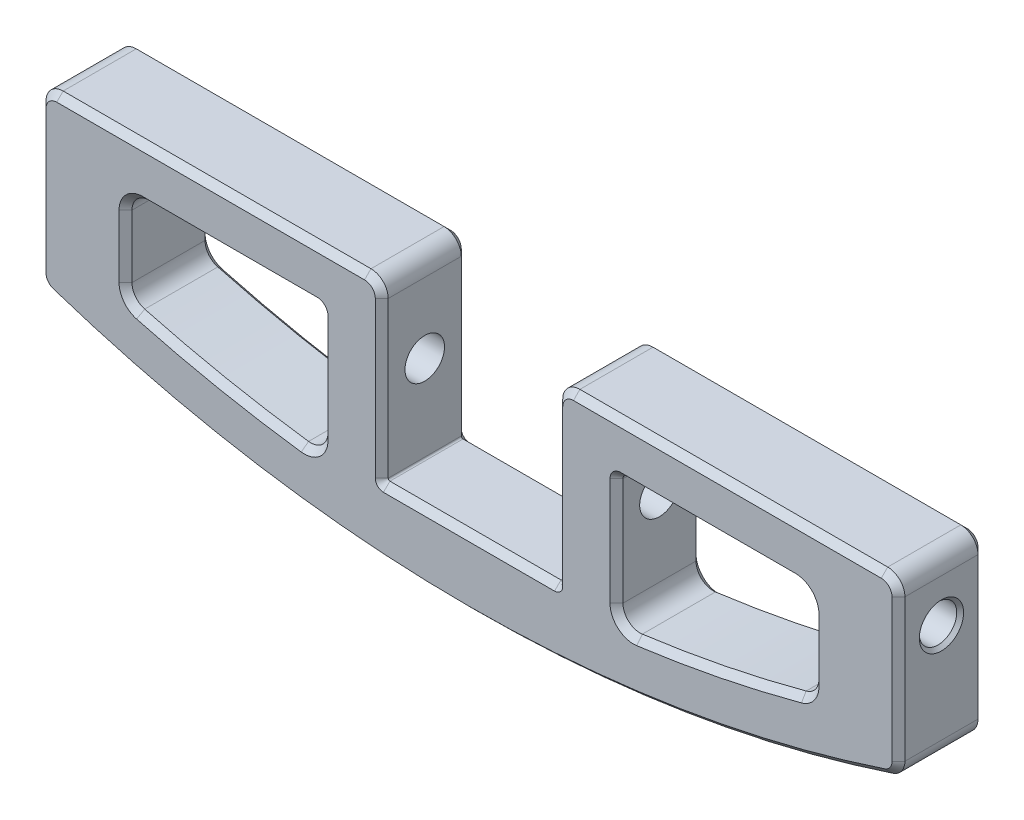
from build123d import *

# Parameters (mm, degrees)
AUFSATZ_LINEAR_AUSTRAGEN1_DEPTH      = 10
SKIZZE2_R                            = 2.175
SCHNITT_LINEAR_AUSTRAGEN1_DEPTH      = 8
SCHNITT_LINEAR_AUSTRAGEN2_DEPTH      = 30
SCHNITT_LINEAR_AUSTRAGEN2_DEPTH_BACK = 10
SKIZZE3_R                            = 2.3
VERRUNDUNG1_R                        = 2
VERRUNDUNG2_R                        = 0.2
VERRUNDUNG3_R                        = 0.5
FASE1_SIZE                           = 0.75
FASE2_SIZE                           = 0.4


with BuildPart() as part:
    # Skizze1 → Aufsatz-Linear austragen1 (new body)
    with BuildSketch(Plane.XY):
        with BuildLine():
            Line((10.15, 0), (10.15, -20.3))
            Line((10.15, -20.3), (-10.15, -20.3))
            Line((-10.15, -20.3), (-10.15, 0))
            Line((-10.15, 0), (-49.95, 0))
            Line((-49.95, 0), (-49.95, -20))
            ThreePointArc((-49.95, -20), (-25.317447047, -26.210871087), (0, -28.3))
            ThreePointArc((0, -28.3), (25.317447047, -26.210871087), (49.95, -20))
            Line((49.95, -20), (49.95, 0))
            Line((49.95, 0), (10.15, 0))
        make_face()
        with BuildLine():
            Line((17.15, -6), (17.15, -21.30603648))
            ThreePointArc((17.15, -21.30603648), (28.637839253, -19.511539955), (39.95, -16.823476023))
            Line((39.95, -16.823476023), (39.95, -6))
            Line((39.95, -6), (17.15, -6))
        make_face(mode=Mode.SUBTRACT)
        with BuildLine():
            Line((-17.15, -6), (-39.95, -6))
            Line((-39.95, -6), (-39.95, -16.823476023))
            ThreePointArc((-39.95, -16.823476023), (-28.637839253, -19.511539955), (-17.15, -21.30603648))
            Line((-17.15, -21.30603648), (-17.15, -6))
        make_face(mode=Mode.SUBTRACT)
    extrude(amount=AUFSATZ_LINEAR_AUSTRAGEN1_DEPTH)

    # Skizze2 → Schnitt-Linear austragen1 (cut)
    with BuildSketch(Plane(origin=(49.95, 0, 0), x_dir=(0, 0, -1), z_dir=(1, 0, 0))):
        with Locations((-5, -7)):
            Circle(SKIZZE2_R)
    schnitt_linear_austragen1 = extrude(amount=-SCHNITT_LINEAR_AUSTRAGEN1_DEPTH, mode=Mode.SUBTRACT)

    # Spiegeln1: Schnitt-Linear austragen1 across plane
    add(schnitt_linear_austragen1.mirror(Plane(origin=(0, 0, 0), x_dir=(0, 0, 1), z_dir=(1, 0, 0))), mode=Mode.SUBTRACT)

    # Skizze3 → Schnitt-Linear austragen2 (cut, two sides: drawn at the far end of the back side and taken through both)
    with BuildSketch(Plane.ZY.offset(-10.15).offset(-SCHNITT_LINEAR_AUSTRAGEN2_DEPTH_BACK)):
        with Locations((5, -10.15)):
            Circle(SKIZZE3_R)
    extrude(amount=SCHNITT_LINEAR_AUSTRAGEN2_DEPTH + SCHNITT_LINEAR_AUSTRAGEN2_DEPTH_BACK, mode=Mode.SUBTRACT)

    # Verrundung1
    verrundung1_edges = [part.edges().sort_by_distance(p)[0] for p in [
        (49.95, 0, 5),
        (-17.15, -21.30603648, 5),
        (-39.95, -16.823476023, 5),
        (-39.95, -6, 5),
        (39.95, -6, 5),
        (39.95, -16.823476023, 5),
        (17.15, -21.30603648, 5),
        (10.15, 0, 5),
        (-10.15, 0, 5),
        (-49.95, 0, 5),
        (-49.95, -20, 5),
        (49.95, -20, 5),
    ]]
    fillet(verrundung1_edges, radius=VERRUNDUNG1_R)

    # Verrundung2
    verrundung2_edges = [part.edges().sort_by_distance(p)[0] for p in [
        (-10.15, -20.3, 5),
        (10.15, -20.3, 5),
    ]]
    fillet(verrundung2_edges, radius=VERRUNDUNG2_R)

    # Verrundung3
    verrundung3_edges = [part.edges().sort_by_distance(p)[0] for p in [
        (-17.15, -6, 5),
        (17.15, -6, 5),
    ]]
    fillet(verrundung3_edges, radius=VERRUNDUNG3_R)

    # Fase1
    fase1_edges = [part.edges().sort_by_distance(p)[0] for p in [
        (-39.364213562, -6.585786438, 0),
        (-27.8, -6, 0),
        (-17.296446609, -6.146446609, 0),
        (-17.15, -12.771286766, 0),
        (-17.831485792, -20.546408723, 0),
        (-29.00206817, -19.439458054, 0),
        (-39.536902903, -16.514831798, 0),
        (-39.95, -11.648782352, 0),
        (39.364213562, -6.585786438, 0),
        (39.95, -11.648782352, 0),
        (39.536902903, -16.514831798, 0),
        (29.00206817, -19.439458054, 0),
        (17.831485792, -20.546408723, 0),
        (17.15, -12.771286766, 0),
        (17.296446609, -6.146446609, 0),
        (27.8, -6, 0),
        (10.735786438, -0.585786438, 0),
        (10.15, -11.05, 0),
        (10.091421356, -20.241421356, 0),
        (0, -20.3, 0),
        (-10.091421356, -20.241421356, 0),
        (-10.15, -11.05, 0),
        (-10.735786438, -0.585786438, 0),
        (-30.05, 0, 0),
        (-49.364213562, -0.585786438, 0),
        (-49.95, -10.281445763, 0),
        (-49.571435511, -19.733765937, 0),
        (0, -28.3, 0),
        (49.571435511, -19.733765937, 0),
        (49.95, -10.281445763, 0),
        (49.364213562, -0.585786438, 0),
        (30.05, 0, 0),
        (-17.296446609, -6.146446609, 10),
        (-27.8, -6, 10),
        (-39.364213562, -6.585786438, 10),
        (-39.95, -11.648782352, 10),
        (-39.536902903, -16.514831798, 10),
        (-29.00206817, -19.439458054, 10),
        (-17.831485792, -20.546408723, 10),
        (-17.15, -12.771286766, 10),
        (49.571435511, -19.733765937, 10),
        (0, -28.3, 10),
        (-49.571435511, -19.733765937, 10),
        (-49.95, -10.281445763, 10),
        (-49.364213562, -0.585786438, 10),
        (-30.05, 0, 10),
        (-10.735786438, -0.585786438, 10),
        (-10.15, -11.05, 10),
        (-10.091421356, -20.241421356, 10),
        (0, -20.3, 10),
        (10.091421356, -20.241421356, 10),
        (10.15, -11.05, 10),
        (10.735786438, -0.585786438, 10),
        (30.05, 0, 10),
        (49.364213562, -0.585786438, 10),
        (49.95, -10.281445763, 10),
        (39.364213562, -6.585786438, 10),
        (27.8, -6, 10),
        (17.296446609, -6.146446609, 10),
        (17.15, -12.771286766, 10),
        (17.831485792, -20.546408723, 10),
        (29.00206817, -19.439458054, 10),
        (39.536902903, -16.514831798, 10),
        (39.95, -11.648782352, 10),
    ]]
    chamfer(fase1_edges, length=FASE1_SIZE)

    # Fase2
    fase2_edges = [part.edges().sort_by_distance(p)[0] for p in [
        (-49.95, -7, 7.175),
        (49.95, -7, 7.175),
    ]]
    chamfer(fase2_edges, length=FASE2_SIZE)


solid = part.part
